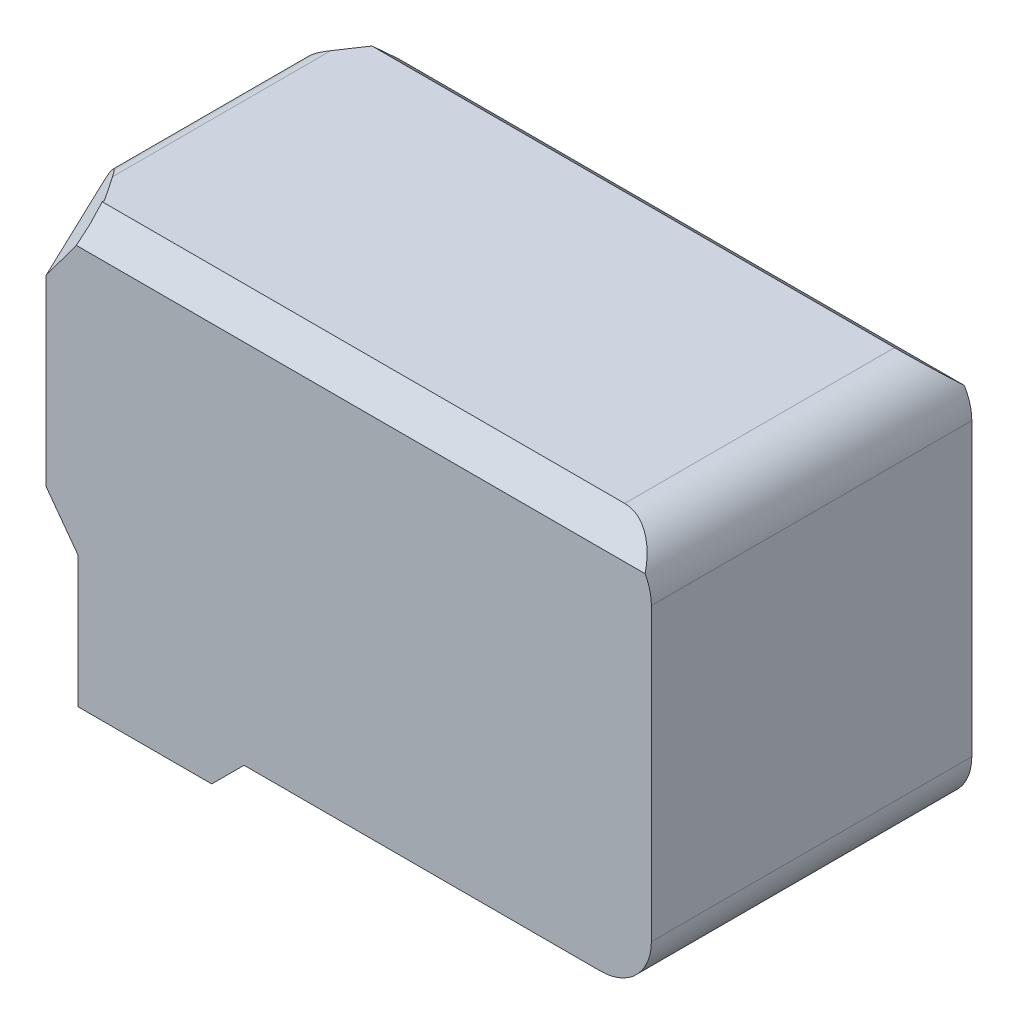
from build123d import *

# Parameters (mm, degrees)
SKETCH2_R           = 1.375
BOSS_EXTRUDE1_DEPTH = 3.125
SKETCH3_R           = 11
BOSS_EXTRUDE2_DEPTH = 4
FILLET1_SIZE        = 3.125
SKETCH4_W           = 31.47
SKETCH4_H           = 41.76
SKETCH4_W_2         = 25.12
SKETCH4_H_2         = 35.41
BOSS_EXTRUDE3_DEPTH = 49.135
CHAMFER1_SIZE       = 2.38
CHAMFER1_SIZE_2     = 2.597314233
BOSS_EXTRUDE4_DEPTH = 3.175
SKETCH6_W           = 40
SKETCH6_H           = 31.47
CUT_EXTRUDE1_DEPTH  = 3.175
CHAMFER2_SIZE       = 3.175
FILLET3_R           = 5
FILLET4_R           = 5
FILLET5_R           = 1.5


# Some blends are built 0.0001 mm under size
with BuildPart() as part:
    # Sketch2 → Boss-Extrude1 (new body)
    with BuildSketch(Plane(origin=(0, 0, 0), x_dir=(0, 0, -1), z_dir=(1, 0, 0))):
        Polygon((0, 15.615), (-8.5, 15.615), (-15.735, 9), (-15.735, 0), (-15.735, -9), (-8.5, -15.615), (0, -15.615), (8.5, -15.615), (15.735, -9), (15.735, 0), (15.735, 9), (8.5, 15.615), align=None)
        with Locations((0, 7)):
            Circle(SKETCH2_R, mode=Mode.SUBTRACT)
        with Locations((-7, 0)):
            Circle(SKETCH2_R, mode=Mode.SUBTRACT)
        with Locations((7, 0)):
            Circle(SKETCH2_R, mode=Mode.SUBTRACT)
        with Locations((0, -7)):
            Circle(SKETCH2_R, mode=Mode.SUBTRACT)
    extrude(amount=BOSS_EXTRUDE1_DEPTH)

    # Sketch3 → Boss-Extrude2 (add)
    with BuildSketch(Plane.ZY.offset(-3.125)):
        Polygon((-15.735, -9), (-15.735, -26.145), (15.735, -26.145), (15.735, -9), (15.735, 9), (15.735, 15.615), (8.5, 15.615), (-8.5, 15.615), (-15.735, 15.615), (-15.735, 9), align=None)
        Circle(SKETCH3_R, mode=Mode.SUBTRACT)
    extrude(amount=-BOSS_EXTRUDE2_DEPTH)

    # Fillet1
    fillet1_edges = [part.edges().sort_by_distance(p)[0] for p in [
        (3.125, 12.3075, 12.1175),
        (3.125, 12.3075, -12.1175),
        (3.125, -12.3075, -12.1175),
        (3.125, -15.615, 0),
        (3.125, -12.3075, 12.1175),
    ]]
    chamfer(fillet1_edges, length=FILLET1_SIZE - 0.0001)  # a hair under: the kernel refuses the full size

    # Sketch4 → Boss-Extrude3 (add)
    with BuildSketch(Plane(origin=(7.125, 0, 0), x_dir=(0, 0, -1), z_dir=(1, 0, 0))):
        with Locations((0, -5.265)):
            Rectangle(SKETCH4_W, SKETCH4_H)
        with Locations((0, -5.265)):
            Rectangle(SKETCH4_W_2, SKETCH4_H_2, mode=Mode.SUBTRACT)
    extrude(amount=BOSS_EXTRUDE3_DEPTH)

    # Chamfer1
    # the kernel refuses this chamfer: 2.597314233, 2.38 mm, written as the material it takes off along each edge
    with BuildSketch(Plane(origin=(-3.562082301, 15.615, 15.735), x_dir=(0, 0.031246667353746232, -0.9995117036729906), z_dir=(1, 0, 0))) as chamfer1_piece_1:
        Polygon((CHAMFER1_SIZE * 0.999511703673, -CHAMFER1_SIZE * 0.0312466673537), (-CHAMFER1_SIZE_2 * 0.0312466673483, -CHAMFER1_SIZE_2 * 0.999511703498), (0, 0), align=None)
    extrude(amount=66.509164603, mode=Mode.SUBTRACT)
    with BuildSketch(Plane(origin=(62.947082301, 15.615, -15.735), x_dir=(0, 0.02624044362699192, 0.999655660274206), z_dir=(-1, 0, 0))) as chamfer1_piece_2:
        Polygon((CHAMFER1_SIZE_2 * 0.999655660099, -CHAMFER1_SIZE_2 * 0.0262404436224), (-CHAMFER1_SIZE * 0.026240443627, -CHAMFER1_SIZE * 0.999655660274), (0, 0), align=None)
    extrude(amount=66.509164603, mode=Mode.SUBTRACT)

    # Sketch5 → Boss-Extrude4 (add)
    with BuildSketch(Plane(origin=(56.26, 0, 0), x_dir=(0, 0, -1), z_dir=(1, 0, 0))):
        Polygon((13.137685767, 15.615), (-13.355, 15.615), (-15.735, 13.017685767), (-15.735, -26.145), (15.735, -26.145), (15.735, 13.235), align=None)
    extrude(amount=BOSS_EXTRUDE4_DEPTH)

    # Sketch6 → Cut-Extrude1 (cut)
    with BuildSketch(Plane.XZ.offset(26.145)):
        with Locations((39.435, 0)):
            Rectangle(SKETCH6_W, SKETCH6_H)
    extrude(amount=-CUT_EXTRUDE1_DEPTH, mode=Mode.SUBTRACT)

    # Chamfer2
    chamfer2_edges = [part.edges().sort_by_distance(p)[0] for p in [
        (19.435, -26.145, 0),
    ]]
    chamfer(chamfer2_edges, length=CHAMFER2_SIZE - 0.0001)  # a hair under: the kernel refuses the full size

    # Fillet3
    fillet3_edges = [part.edges().sort_by_distance(p)[0] for p in [
        (59.435, 15.615, 0.108657116),
    ]]
    fillet(fillet3_edges, radius=FILLET3_R)

    # Fillet4
    # the kernel refuses this fillet: 5 mm, written as the material it takes off along each edge
    with BuildSketch(Plane(origin=(59.435, -22.97, -28.235), x_dir=(0, 1, 0), z_dir=(0, 0, 1))) as fillet4_piece_1:
        with BuildLine():
            CenterArc((FILLET4_R, FILLET4_R), FILLET4_R, 180, 90)
            Line((0, FILLET4_R), (0, 0))
            Line((0, 0), (FILLET4_R, 0))
        make_face()
    extrude(amount=56.47, mode=Mode.SUBTRACT)

    # Fillet5
    fillet5_edges = [part.edges().sort_by_distance(p)[0] for p in [
        (0, 15.615, 0),
    ]]
    fillet(fillet5_edges, radius=FILLET5_R)


solid = part.part
